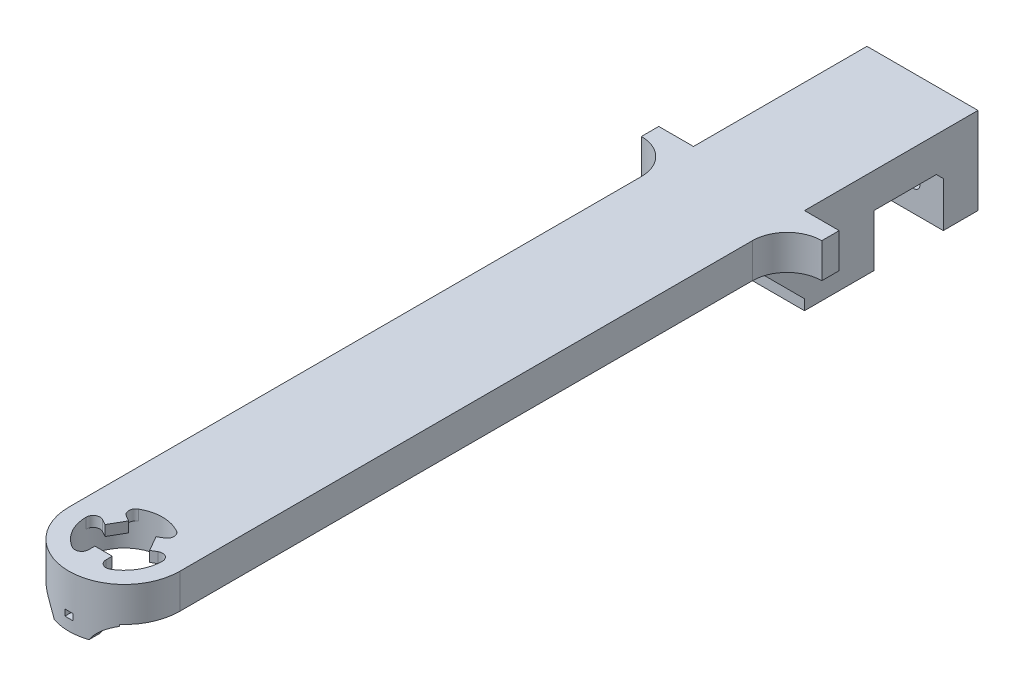
from build123d import *

# Parameters (mm, degrees)
BOSS_EXTRUDE1_DEPTH = 10
SKETCH2_W           = 32
SKETCH2_H           = 15
SKETCH2_R           = 1.75
BOSS_EXTRUDE2_DEPTH = 10
CHAMFER1_SIZE       = 2
SKETCH3_W           = 5
SKETCH3_H           = 5
BOSS_EXTRUDE5_DEPTH = 3
BOSS_EXTRUDE6_START = -5
BOSS_EXTRUDE6_DEPTH = 5
SKETCH7_W           = 2.3
SKETCH7_H           = 1.8
CUT_EXTRUDE2_DEPTH  = 243.991769408
FILLET2_R           = 2
SKETCH8_W           = 10
SKETCH8_H           = 5
BOSS_EXTRUDE7_DEPTH = 10
FILLET3_R           = 10
SKETCH9_W           = 32
SKETCH9_H           = 15
BOSS_EXTRUDE8_DEPTH = 20
FILLET4_R           = 10
CHAMFER2_SIZE       = 12


# Some blends are built 0.0001 mm under size
with BuildPart() as part:
    # Sketch1 → Boss-Extrude1 (new body)
    with BuildSketch(Plane(origin=(0, 0, 0), x_dir=(1, 0, 0), z_dir=(0, 1, 0))):
        with BuildLine():
            ThreePointArc((-16, 0), (0, 16), (16, 0))
            Line((16, 0), (16, 230))
            Line((16, 230), (-16, 230))
            Line((-16, 230), (-16, 0))
        make_face()
        with BuildLine():
            ThreePointArc((-11, 0), (0, 11), (11, 0))
            Line((11, 0), (16, 0))
            ThreePointArc((16, 0), (0, 16), (-16, 0))
            Line((-16, 0), (-11, 0))
        make_face()
        with BuildLine():
            Line((16, 0), (11, 0))
            ThreePointArc((11, 0), (0, -11), (-11, 0))
            Line((-11, 0), (-16, 0))
            ThreePointArc((-16, 0), (0, -16), (16, 0))
        make_face()
    extrude(amount=BOSS_EXTRUDE1_DEPTH)

    # Sketch2 → Boss-Extrude2 (add)
    with BuildSketch(Plane(origin=(0, 0, -230), x_dir=(-1, 0, 0), z_dir=(0, 0, -1))):
        with Locations((0, -7.5)):
            Rectangle(SKETCH2_W, SKETCH2_H)
        with Locations((-7.5, -7)):
            Circle(SKETCH2_R, mode=Mode.SUBTRACT)
        with Locations(Location((7.5, -7, 0), (0, 0, 180))):
            Circle(SKETCH2_R, mode=Mode.SUBTRACT)
    extrude(amount=-BOSS_EXTRUDE2_DEPTH)

    # Chamfer1
    chamfer1_edges = [part.edges().sort_by_distance(p)[0] for p in [
        (0, 0, -220),
    ]]
    chamfer(chamfer1_edges, length=CHAMFER1_SIZE)

    # Sketch3 → Boss-Extrude5 (add)
    with BuildSketch(Plane.XZ.offset(-10)):
        with Locations((0, 8.5)):
            Rectangle(SKETCH3_W, SKETCH3_H)
        Polygon((10.776279442, -3.334936491), (6.446152423, -0.834936491), (3.946152423, -5.165063509), (8.276279442, -7.665063509), align=None)
        Polygon((-8.276279442, -7.665063509), (-3.946152423, -5.165063509), (-6.446152423, -0.834936491), (-10.776279442, -3.334936491), align=None)
    extrude(amount=BOSS_EXTRUDE5_DEPTH)

    # Sketch4 → Boss-Extrude6 (add)
    with BuildSketch(Plane(origin=(0, 0, 0), x_dir=(1, 0, 0), z_dir=(0, 1, 0)).offset(BOSS_EXTRUDE6_START)):
        with BuildLine():
            Line((5, -12), (-5, -12))
            Line((-5, -12), (-5, -15.198684154))
            ThreePointArc((-5, -15.198684154), (0, -16), (5, -15.198684154))
            Line((5, -15.198684154), (5, -12))
        make_face()
    extrude(amount=BOSS_EXTRUDE6_DEPTH)

    # Sketch7 → Cut-Extrude2 (cut, through all)
    with BuildSketch(Plane(origin=(0, 0, 12), x_dir=(-1, 0, 0), z_dir=(0, 0, -1))):
        with Locations((0, -0.9)):
            Rectangle(SKETCH7_W, SKETCH7_H)
    extrude(amount=-CUT_EXTRUDE2_DEPTH, mode=Mode.SUBTRACT)

    # Fillet2
    fillet2_edges = [part.edges().sort_by_distance(p)[0] for p in [
        (2.5, 8.5, 10.712142643),
        (-2.5, 8.5, 10.712142643),
        (8.026987658, 8.5, -7.521134831),
        (10.526987658, 8.5, -3.191007812),
        (-10.526987658, 8.5, -3.191007812),
        (-8.026987658, 8.5, -7.521134831),
    ]]
    fillet(fillet2_edges, radius=FILLET2_R - 0.0001)  # a hair under: the kernel refuses the full size

    # Sketch8 → Boss-Extrude7 (add)
    with BuildSketch(Plane.XZ):
        with Locations((21, -177.5)):
            Rectangle(SKETCH8_W, SKETCH8_H)
        with Locations((-21, -177.5)):
            Rectangle(SKETCH8_W, SKETCH8_H)
    extrude(amount=-BOSS_EXTRUDE7_DEPTH)

    # Fillet3
    fillet3_edges = [part.edges().sort_by_distance(p)[0] for p in [
        (16, 5, -175),
        (-16, 5, -175),
    ]]
    fillet(fillet3_edges, radius=FILLET3_R - 0.0001)  # a hair under: the kernel refuses the full size

    # Sketch9 → Boss-Extrude8 (add)
    with BuildSketch(Plane(origin=(0, 0, -180), x_dir=(-1, 0, 0), z_dir=(0, 0, -1))):
        with Locations((0, -7.5)):
            Rectangle(SKETCH9_W, SKETCH9_H)
    extrude(amount=BOSS_EXTRUDE8_DEPTH)

    # Fillet4
    # the kernel refuses this fillet: 10 mm, written as the material it adds along each edge
    with BuildSketch(Plane(origin=(-5, 0, 12), x_dir=(-1, 0, 0), z_dir=(0, 0, 1))) as fillet4_piece_1_section:
        with BuildLine():
            CenterArc((8.660254038, 10), FILLET4_R, 210, 60)
            Line((0, 5), (0, 0))
            Line((0, 0), (8.660254038, 0))
        make_face()
    fillet4_piece_1 = extrude(amount=24.849319248, mode=Mode.PRIVATE)
    fillet4_piece_1 = fillet4_piece_1 & Plane(origin=(0, 0, 0), x_dir=(-1, 0, 0), z_dir=(0, -1, 0)) * Cylinder(16, 85, mode=Mode.PRIVATE)
    add(fillet4_piece_1)
    with BuildSketch(Plane(origin=(5, 0, 36.849319248), x_dir=(1, 0, 0), z_dir=(0, 0, -1))) as fillet4_piece_2_section:
        with BuildLine():
            CenterArc((8.660254038, 10), FILLET4_R, 210, 60)
            Line((0, 5), (0, 0))
            Line((0, 0), (8.660254038, 0))
        make_face()
    fillet4_piece_2 = extrude(amount=24.849319248, mode=Mode.PRIVATE)
    fillet4_piece_2 = fillet4_piece_2 & Plane(origin=(0, 0, 0), x_dir=(-1, 0, 0), z_dir=(0, -1, 0)) * Cylinder(16, 85, mode=Mode.PRIVATE)
    add(fillet4_piece_2)

    # Chamfer2
    chamfer2_edges = [part.edges().sort_by_distance(p)[0] for p in [
        (0, 0, -180),
    ]]
    chamfer(chamfer2_edges, length=CHAMFER2_SIZE)


solid = part.part
